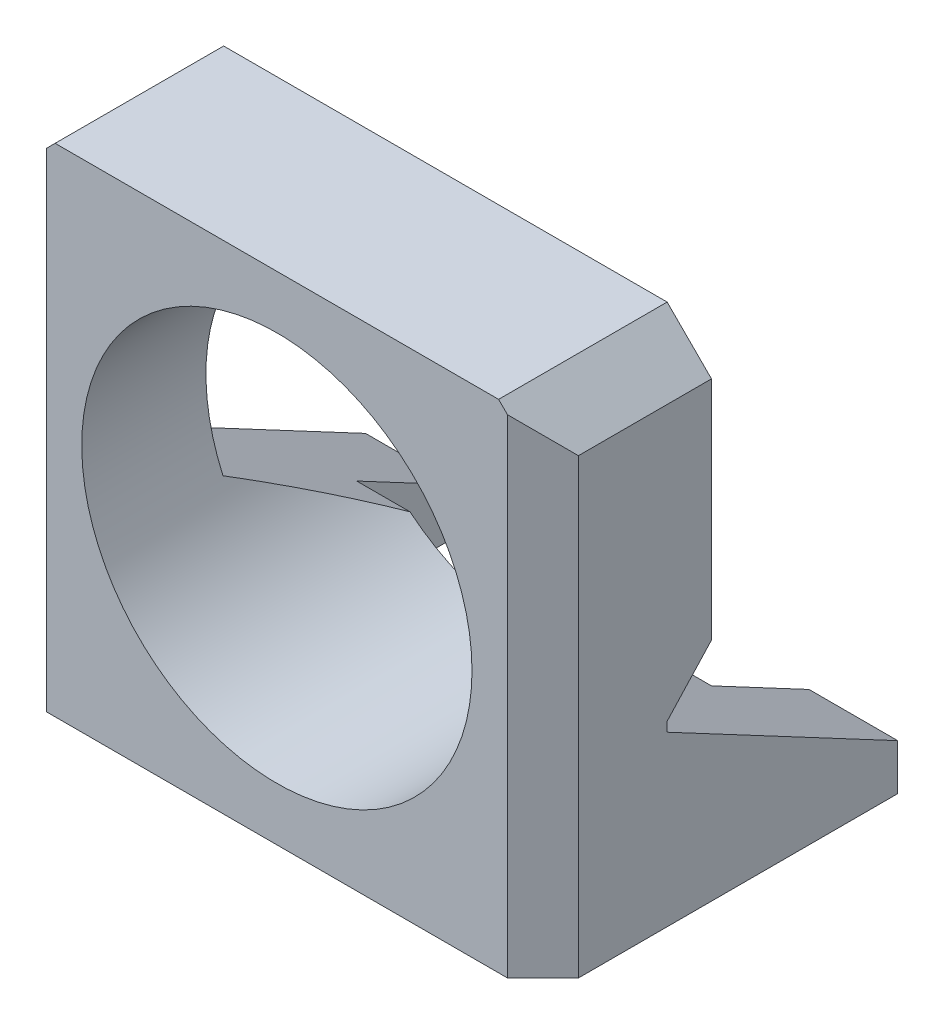
from build123d import *

# Parameters (mm, degrees)
SKETCH1_R           = 11
BOSS_EXTRUDE1_DEPTH = 7
SKETCH2_W           = 5
SKETCH2_H           = 2.5
BOSS_EXTRUDE2_DEPTH = 13
CHAMFER2_SIZE       = 2
BOSS_EXTRUDE6_DEPTH = 2.5
CHAMFER3_SIZE       = 2
CHAMFER4_SIZE       = 2
BOSS_EXTRUDE4_DEPTH = 2.5
CHAMFER6_SIZE       = 2.5
CHAMFER7_SIZE       = 7
CHAMFER7_SIZE_2     = 13.165085257
CUT_EXTRUDE1_START  = -3
SKETCH6_R           = 2
CUT_EXTRUDE1_DEPTH  = 2.5
SKETCH7_R           = 2
CUT_EXTRUDE2_DEPTH  = 6


with BuildPart() as part:
    # Sketch1 → Boss-Extrude1 (new body)
    with BuildSketch(Plane.XY):
        Polygon((-15, 11.5), (-12.5, 14), (12.5, 14), (15, 11.5), (15, -14), (-15, -14), align=None)
        Circle(SKETCH1_R, mode=Mode.SUBTRACT)
    extrude(amount=BOSS_EXTRUDE1_DEPTH)

    # Sketch2 → Boss-Extrude2 (add)
    with BuildSketch(Plane(origin=(0, 0, 0), x_dir=(-1, 0, 0), z_dir=(0, 0, -1))):
        with Locations((-12.5, -12.75)):
            Rectangle(SKETCH2_W, SKETCH2_H)
        with Locations((12.5, -12.75)):
            Rectangle(SKETCH2_W, SKETCH2_H)
    extrude(amount=BOSS_EXTRUDE2_DEPTH)

    # Chamfer2
    chamfer2_edges = [part.edges().sort_by_distance(p)[0] for p in [
        (-10, -12.75, 0),
        (10, -12.75, 0),
    ]]
    chamfer(chamfer2_edges, length=CHAMFER2_SIZE)

    # Sketch5 → Boss-Extrude6 (add)
    with BuildSketch(Plane.XZ.offset(14)):
        Polygon((-10, -2), (-10, -7.5), (10, -7.5), (10, -2), (8, 0), (-8, 0), align=None)
    extrude(amount=-BOSS_EXTRUDE6_DEPTH)

    # Chamfer3
    chamfer3_edges = [part.edges().sort_by_distance(p)[0] for p in [
        (15, -1.25, 7),
    ]]
    chamfer(chamfer3_edges, length=CHAMFER3_SIZE)

    # Chamfer4
    chamfer4_edges = [part.edges().sort_by_distance(p)[0] for p in [
        (-15, -1.25, 7),
    ]]
    chamfer(chamfer4_edges, length=CHAMFER4_SIZE)

    # Sketch4 → Boss-Extrude4 (add)
    with BuildSketch(Plane(origin=(0, 0, 0), x_dir=(-1, 0, 0), z_dir=(0, 0, -1))):
        Polygon((-15, -1.25), (15, 11.5), (12.5, 14), (-12.5, 14), (-15, 11.5), align=None)
    extrude(amount=BOSS_EXTRUDE4_DEPTH)

    # Chamfer6
    # the kernel refuses this chamfer: 2.5 mm, written as the material it adds along each edge
    with BuildSketch(Plane(origin=(20.916998416, -3.764724327, 0), x_dir=(-0.39099275668343275, -0.9199829569021947, 0.02749587661058635), z_dir=(-0.9203309184584746, 0.39114064034485174, 0))) as chamfer6_piece_1_section:
        Polygon((CHAMFER6_SIZE * 0.999621916911, -CHAMFER6_SIZE * 0.0274958766106), (-CHAMFER6_SIZE * 0.0274958766106, -CHAMFER6_SIZE * 0.999621916911), (0, 0), align=None)
    chamfer6_piece_1 = extrude(amount=17.214861222, mode=Mode.PRIVATE)
    chamfer6_piece_1 = chamfer6_piece_1 - Plane(origin=(0, 0, -0.830769879), x_dir=(1, 0, 0), z_dir=(0, 0, -1)) * Cylinder(11, 45, mode=Mode.PRIVATE)
    chamfer6_piece_1 = split(chamfer6_piece_1, bisect_by=Plane(origin=(15, -1.305255327, -0.830769879), z_dir=(-1, 0, 0)), keep=Keep.TOP, mode=Mode.PRIVATE)
    add(chamfer6_piece_1)
    with BuildSketch(Plane(origin=(-1.383846422, 5.71313473, 0), x_dir=(-0.39099275668343275, -0.9199829569021946, 0.02749587661058637), z_dir=(-0.9203309184584746, 0.39114064034485174, 0))) as chamfer6_piece_2_section:
        Polygon((CHAMFER6_SIZE * 0.999621916911, -CHAMFER6_SIZE * 0.0274958766106), (-CHAMFER6_SIZE * 0.0274958766106, -CHAMFER6_SIZE * 0.999621916911), (0, 0), align=None)
    chamfer6_piece_2 = extrude(amount=21.224052785, mode=Mode.PRIVATE)
    chamfer6_piece_2 = chamfer6_piece_2 - Plane(origin=(0, 0, -0.851096237), x_dir=(1, 0, 0), z_dir=(0, 0, -1)) * Cylinder(11, 53, mode=Mode.PRIVATE)
    chamfer6_piece_2 = split(chamfer6_piece_2, bisect_by=Plane(origin=(-15, 9.126408424, -0.851096237), z_dir=(1, 0, 0)), keep=Keep.TOP, mode=Mode.PRIVATE)
    add(chamfer6_piece_2)

    # Chamfer7
    # the kernel refuses this chamfer: 13.165085257, 7 mm, written as the material it adds along each edge
    with BuildSketch(Plane(origin=(-15, -11.5, 0), x_dir=(0, 0.9979482451756082, 0.06402577567608186), z_dir=(1, 0, 0))) as chamfer7_piece_1_section:
        Polygon((CHAMFER7_SIZE * 0.997948245176, -CHAMFER7_SIZE * 0.0640257756761), (-CHAMFER7_SIZE_2 * 0.0640257756781, -CHAMFER7_SIZE_2 * 0.997948245208), (0, 0), align=None)
    chamfer7_piece_1 = extrude(amount=30, mode=Mode.PRIVATE)
    chamfer7_piece_1 = chamfer7_piece_1 - Plane(origin=(0, 0, -3.073682767), x_dir=(1, 0, 0), z_dir=(0, 0, -1)) * Cylinder(11, 113, mode=Mode.PRIVATE)
    chamfer7_piece_1 = split(chamfer7_piece_1, bisect_by=Plane(origin=(-12.500128058, -8.887755394, -7.5), z_dir=(0, 0, 1)), keep=Keep.TOP, mode=Mode.PRIVATE)
    chamfer7_piece_1 = split(chamfer7_piece_1, bisect_by=Plane(origin=(-10, -8.887755394, -3.073682767), z_dir=(-1, 0, 0)), keep=Keep.TOP, mode=Mode.PRIVATE)
    add(chamfer7_piece_1)
    with BuildSketch(Plane(origin=(-15, -11.5, 0), x_dir=(0, 0.9979482451756082, 0.06402577567608186), z_dir=(1, 0, 0))) as chamfer7_piece_2_section:
        Polygon((CHAMFER7_SIZE * 0.997948245176, -CHAMFER7_SIZE * 0.0640257756761), (-CHAMFER7_SIZE_2 * 0.0640257756781, -CHAMFER7_SIZE_2 * 0.997948245208), (0, 0), align=None)
    chamfer7_piece_2 = extrude(amount=30, mode=Mode.PRIVATE)
    chamfer7_piece_2 = split(chamfer7_piece_2, bisect_by=Plane(origin=(-12.5, -10.721530873, -7.5), z_dir=(0, 0, -1)), keep=Keep.TOP, mode=Mode.PRIVATE)
    chamfer7_piece_2 = split(chamfer7_piece_2, bisect_by=Plane(origin=(-10, -10.721530873, -9.597564575), z_dir=(-1, 0, 0)), keep=Keep.TOP, mode=Mode.PRIVATE)
    chamfer7_piece_2 = split(chamfer7_piece_2, bisect_by=Plane(origin=(-12.5, -10.721530873, -13), z_dir=(0, 0, 1)), keep=Keep.TOP, mode=Mode.PRIVATE)
    add(chamfer7_piece_2)
    with BuildSketch(Plane(origin=(-15, -11.5, 0), x_dir=(0, 0.9979482451756082, 0.06402577567608186), z_dir=(1, 0, 0))) as chamfer7_piece_3_section:
        Polygon((CHAMFER7_SIZE * 0.997948245176, -CHAMFER7_SIZE * 0.0640257756761), (-CHAMFER7_SIZE_2 * 0.0640257756781, -CHAMFER7_SIZE_2 * 0.997948245208), (0, 0), align=None)
    chamfer7_piece_3 = extrude(amount=30, mode=Mode.PRIVATE)
    chamfer7_piece_3 = chamfer7_piece_3 - Plane(origin=(0, 0, -3.793876077), x_dir=(1, 0, 0), z_dir=(0, 0, -1)) * Cylinder(11, 113, mode=Mode.PRIVATE)
    chamfer7_piece_3 = split(chamfer7_piece_3, bisect_by=Plane(origin=(-9.499486782, -6.598719884, -7.5), z_dir=(0, 0, 1)), keep=Keep.TOP, mode=Mode.PRIVATE)
    chamfer7_piece_3 = split(chamfer7_piece_3, bisect_by=Plane(origin=(10, -6.598719884, -3.793876077), z_dir=(-1, 0, 0)), keep=Keep.TOP, mode=Mode.PRIVATE)
    chamfer7_piece_3 = split(chamfer7_piece_3, bisect_by=Plane(origin=(-10, -6.598719884, -3.793876077), z_dir=(1, 0, 0)), keep=Keep.TOP, mode=Mode.PRIVATE)
    add(chamfer7_piece_3)
    with BuildSketch(Plane(origin=(-15, -11.5, 0), x_dir=(0, 0.9979482451756082, 0.06402577567608186), z_dir=(1, 0, 0))) as chamfer7_piece_4_section:
        Polygon((CHAMFER7_SIZE * 0.997948245176, -CHAMFER7_SIZE * 0.0640257756761), (-CHAMFER7_SIZE_2 * 0.0640257756781, -CHAMFER7_SIZE_2 * 0.997948245208), (0, 0), align=None)
    chamfer7_piece_4 = extrude(amount=30, mode=Mode.PRIVATE)
    chamfer7_piece_4 = split(chamfer7_piece_4, bisect_by=Plane(origin=(12.5, -10.721530873, -7.5), z_dir=(0, 0, -1)), keep=Keep.TOP, mode=Mode.PRIVATE)
    chamfer7_piece_4 = split(chamfer7_piece_4, bisect_by=Plane(origin=(10, -10.721530873, -9.597564575), z_dir=(1, 0, 0)), keep=Keep.TOP, mode=Mode.PRIVATE)
    chamfer7_piece_4 = split(chamfer7_piece_4, bisect_by=Plane(origin=(12.5, -10.721530873, -13), z_dir=(0, 0, 1)), keep=Keep.TOP, mode=Mode.PRIVATE)
    add(chamfer7_piece_4)
    with BuildSketch(Plane(origin=(-15, -11.5, 0), x_dir=(0, 0.9979482451756082, 0.06402577567608186), z_dir=(1, 0, 0))) as chamfer7_piece_5_section:
        Polygon((CHAMFER7_SIZE * 0.997948245176, -CHAMFER7_SIZE * 0.0640257756761), (-CHAMFER7_SIZE_2 * 0.0640257756781, -CHAMFER7_SIZE_2 * 0.997948245208), (0, 0), align=None)
    chamfer7_piece_5 = extrude(amount=30, mode=Mode.PRIVATE)
    chamfer7_piece_5 = chamfer7_piece_5 - Plane(origin=(0, 0, -3.073682766), x_dir=(1, 0, 0), z_dir=(0, 0, -1)) * Cylinder(11, 113, mode=Mode.PRIVATE)
    chamfer7_piece_5 = split(chamfer7_piece_5, bisect_by=Plane(origin=(12.500128057, -8.887755394, -7.5), z_dir=(0, 0, 1)), keep=Keep.TOP, mode=Mode.PRIVATE)
    chamfer7_piece_5 = split(chamfer7_piece_5, bisect_by=Plane(origin=(10, -8.887755394, -3.073682766), z_dir=(1, 0, 0)), keep=Keep.TOP, mode=Mode.PRIVATE)
    add(chamfer7_piece_5)

    # Sketch6 → Cut-Extrude1 (cut)
    # profile 1 of 2: a face of its own
    with BuildSketch(Plane.XZ.offset(14).offset(CUT_EXTRUDE1_START)):
        Polygon((-7.55, 0.508141571), (-7.55, 4.491858429), (-11, 6.483716857), (-14.45, 4.491858429), (-14.45, 0.508141571), (-11, -1.483716857), align=None)
        with Locations(Location((-11, 2.5, 0), (0, 0, 270))):
            Circle(SKETCH6_R, mode=Mode.SUBTRACT)
    # profile 2 of 2: a face of its own
    with BuildSketch(Plane.XZ.offset(14).offset(CUT_EXTRUDE1_START)):
        Polygon((11, -1.483716857), (7.55, 0.508141571), (7.55, 4.491858429), (11, 6.483716857), (14.45, 4.491858429), (14.45, 0.508141571), align=None)
    extrude(amount=-CUT_EXTRUDE1_DEPTH, mode=Mode.SUBTRACT)

    # Sketch7 → Cut-Extrude2 (cut)
    with BuildSketch(Plane.XZ.offset(14)):
        with Locations(Location((11, 2.5, 0), (0, 0, 270))):
            Circle(SKETCH7_R)
        with Locations(Location((-11, 2.5, 0), (0, 0, 270))):
            Circle(SKETCH7_R)
    extrude(amount=-CUT_EXTRUDE2_DEPTH, mode=Mode.SUBTRACT)


solid = part.part
